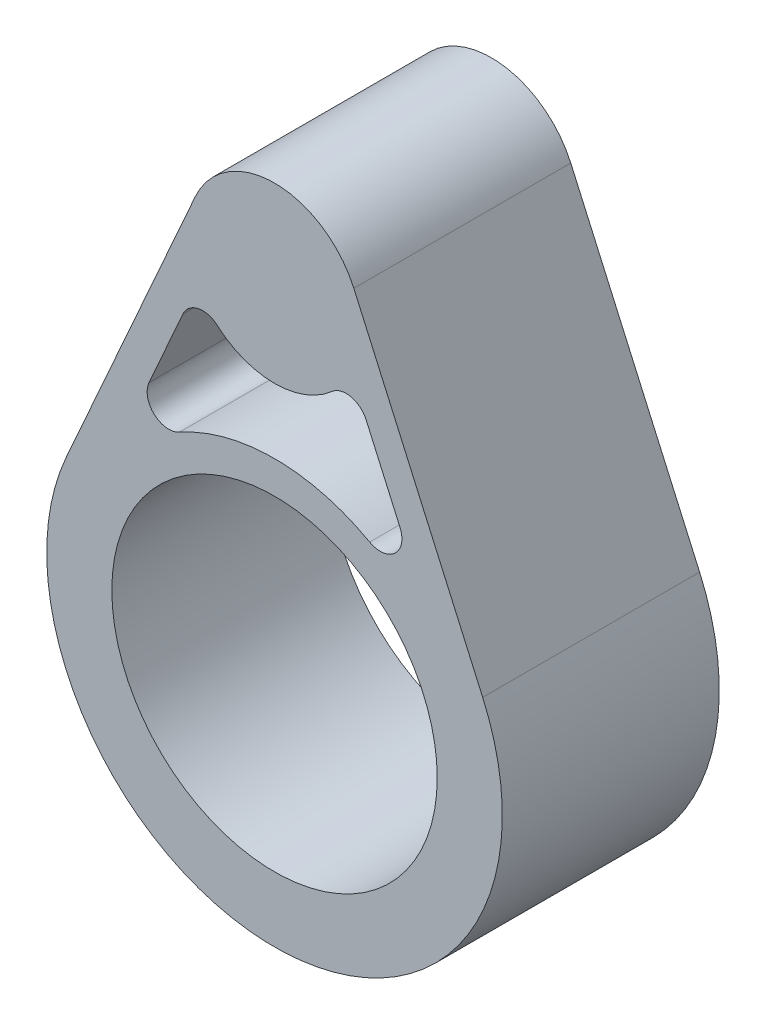
from build123d import *

# Parameters (mm, degrees)
SKETCH1_R               = 75
BOSS_EXTRUDE1_DEPTH     = 50
CUT_EXTRUDE1_DEPTH      = 290.39592257
CUT_EXTRUDE1_DEPTH_BACK = 290.39592257
FILLET1_START           = -50
FILLET1_DEPTH           = 100


with BuildPart() as part:
    # Sketch1 → Boss-Extrude1 (new, symmetric)
    with BuildSketch(Plane.XY):
        with BuildLine():
            Line((-95.945006832, -117.34375), (-36.550478793, 16.25))
            ThreePointArc((-36.550478793, 16.25), (0, 40), (36.550478793, 16.25))
            Line((36.550478793, 16.25), (95.945006832, -117.34375))
            ThreePointArc((95.945006832, -117.34375), (0, -265), (-95.945006832, -117.34375))
        make_face()
        with Locations((0, -160)):
            Circle(SKETCH1_R, mode=Mode.SUBTRACT)
    extrude(amount=BOSS_EXTRUDE1_DEPTH, both=True)

    # Sketch2 → Cut-Extrude1 (cut, two sides: drawn at the far end of the back side and taken through both)
    with BuildSketch(Plane.XY.offset(-CUT_EXTRUDE1_DEPTH_BACK)):
        with BuildLine():
            Line((-35.52920143, -18.375958363), (-82.238577284, -123.4375))
            ThreePointArc((-82.238577284, -123.4375), (0, -70), (82.238577284, -123.4375))
            Line((82.238577284, -123.4375), (35.52920143, -18.375958363))
            ThreePointArc((35.52920143, -18.375958363), (0, -40), (-35.52920143, -18.375958363))
        make_face()
    extrude(amount=CUT_EXTRUDE1_DEPTH + CUT_EXTRUDE1_DEPTH_BACK, mode=Mode.SUBTRACT)

    # Fillet1: read off the stored shape, not the designer's step
    # Fillet1 outline → Fillet1 (add)
    with BuildSketch(Plane.XY.offset(FILLET1_START)):
        with BuildLine():
            ThreePointArc((-42.220939274, -33.427418189), (-35.213916082, -27.719526256), (-26.466655661, -29.991934551))
            ThreePointArc((-26.466655661, -29.991934551), (-31.537347698, -24.604790188), (-35.52920143, -18.375958363))
            Line((-35.52920143, -18.375958363), (-42.220939274, -33.427418189))
        make_face()
        with BuildLine():
            ThreePointArc((35.52920143, -18.375958363), (31.537347698, -24.604790188), (26.466655661, -29.991934551))
            ThreePointArc((26.466655661, -29.991934551), (35.213916082, -27.719526256), (42.220939274, -33.427418189))
            Line((42.220939274, -33.427418189), (35.52920143, -18.375958363))
        make_face()
        with BuildLine():
            ThreePointArc((-43.853361827, -81.406853629), (-55.469552548, -80.058313703), (-57.863577284, -68.61178181))
            Line((-57.863577284, -68.61178181), (-82.238577284, -123.4375))
            ThreePointArc((-82.238577284, -123.4375), (-66.45628703, -99.30764534), (-43.853361827, -81.406853629))
        make_face()
        with BuildLine():
            Line((82.238577284, -123.4375), (57.863577284, -68.61178181))
            ThreePointArc((57.863577284, -68.61178181), (55.469552548, -80.058313703), (43.853361827, -81.406853629))
            ThreePointArc((43.853361827, -81.406853629), (66.45628703, -99.30764534), (82.238577284, -123.4375))
        make_face()
    extrude(amount=FILLET1_DEPTH)


solid = part.part
